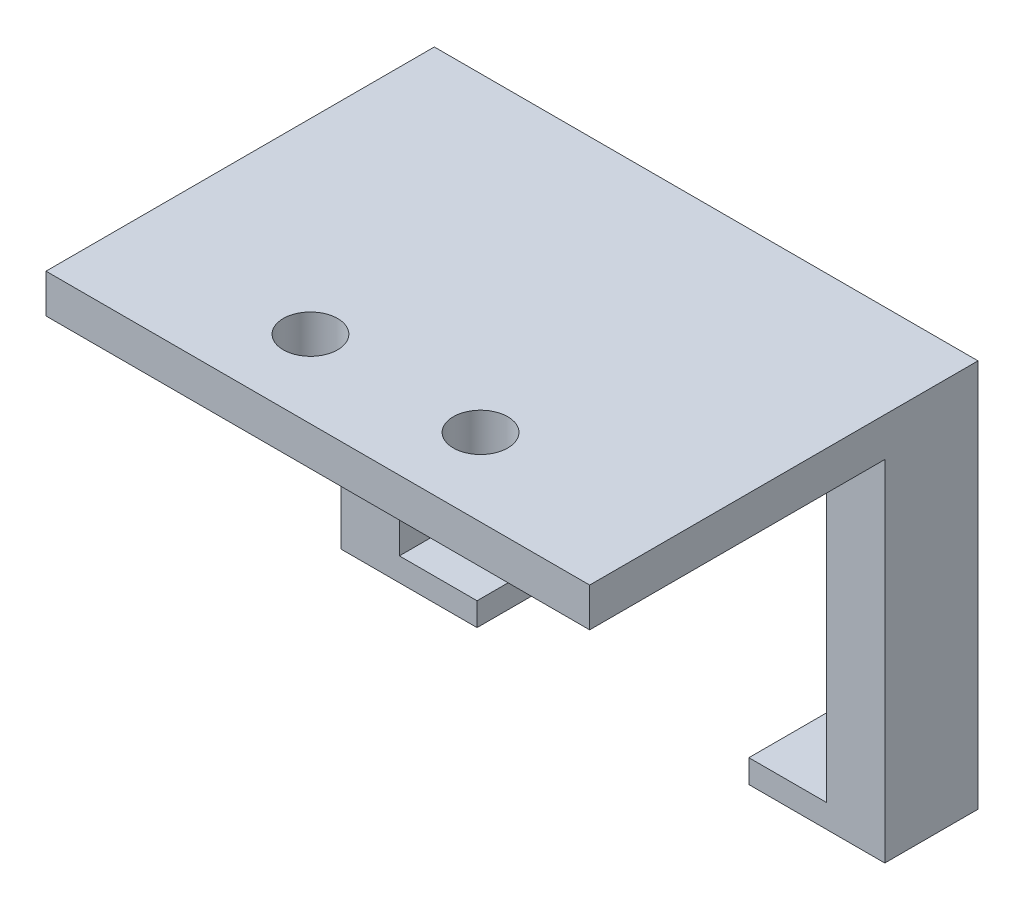
from build123d import *

# Parameters (mm, degrees)
SKETCH3_W           = 35.56
SKETCH3_H           = 25.4
SKETCH3_R           = 1.778
BOSS_EXTRUDE3_DEPTH = 2.54
SKETCH4_W           = 3.81
SKETCH4_H           = 11.176
BOSS_EXTRUDE4_DEPTH = 22.86
SKETCH5_W           = 11.176
SKETCH5_H           = 1.524
BOSS_EXTRUDE5_DEPTH = 5.08
SKETCH6_W           = 11.176
SKETCH6_H           = 1.524
BOSS_EXTRUDE6_DEPTH = 5.08
SKETCH7_W           = 35.56
SKETCH7_H           = 22.86
CUT_EXTRUDE1_DEPTH  = 5.08


with BuildPart() as part:
    # Sketch3 → Boss-Extrude3 (new body)
    with BuildSketch(Plane(origin=(0, 0, 0), x_dir=(1, 0, 0), z_dir=(0, 1, 0))):
        with Locations((6.262748092, -0.232671756)):
            Rectangle(SKETCH3_W, SKETCH3_H)
        with Locations((0.700148092, -7.852671756)):
            Circle(SKETCH3_R, mode=Mode.SUBTRACT)
        with Locations((11.825348092, -7.852671756)):
            Circle(SKETCH3_R, mode=Mode.SUBTRACT)
    extrude(amount=BOSS_EXTRUDE3_DEPTH)

    # Sketch4 → Boss-Extrude4 (add)
    with BuildSketch(Plane.XZ):
        with Locations((-9.612251908, -6.879328244)):
            Rectangle(SKETCH4_W, SKETCH4_H)
        with Locations((22.137748092, -6.879328244)):
            Rectangle(SKETCH4_W, SKETCH4_H)
    extrude(amount=BOSS_EXTRUDE4_DEPTH)

    # Sketch5 → Boss-Extrude5 (add)
    with BuildSketch(Plane(origin=(-7.707251908, 0, 0), x_dir=(0, 0, -1), z_dir=(1, 0, 0))):
        with Locations((6.879328244, -22.098)):
            Rectangle(SKETCH5_W, SKETCH5_H)
    extrude(amount=BOSS_EXTRUDE5_DEPTH)

    # Sketch6 → Boss-Extrude6 (add)
    with BuildSketch(Plane.ZY.offset(-20.232748092)):
        with Locations((-6.879328244, -22.098)):
            Rectangle(SKETCH6_W, SKETCH6_H)
    extrude(amount=BOSS_EXTRUDE6_DEPTH)

    # Sketch7 → Cut-Extrude1 (cut)
    with BuildSketch(Plane.XY.offset(-1.291328244)):
        with Locations((6.262748092, -11.43)):
            Rectangle(SKETCH7_W, SKETCH7_H)
    extrude(amount=-CUT_EXTRUDE1_DEPTH, mode=Mode.SUBTRACT)


solid = part.part
